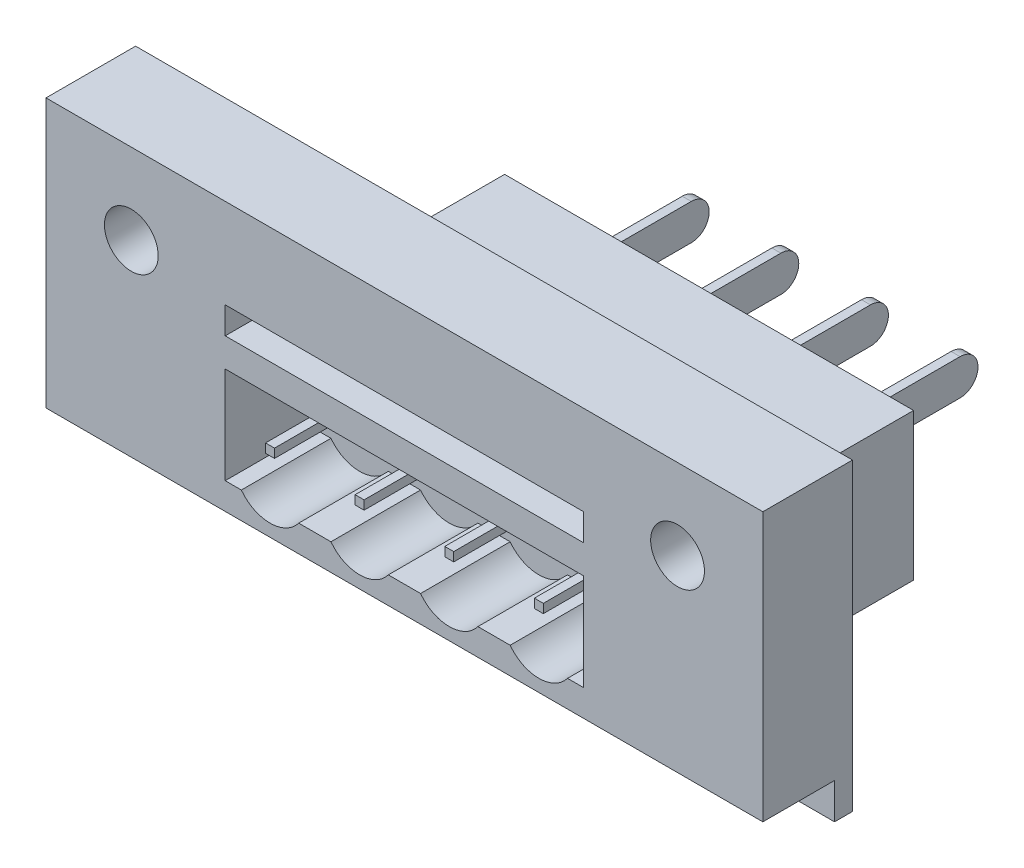
from build123d import *

# Parameters (mm, degrees)
SKETCH1_R              = 1.5
SKETCH1_W              = 20
SKETCH1_H              = 1.5
SKETCH1_W_2            = 22.82
SKETCH1_H_2            = 7.086
BOSS_EXTRUDE1_DEPTH    = 5
SKETCH1_3_W            = 22.82
SKETCH1_3_H            = 1.114
BOSS_EXTRUDE2_DEPTH    = 1
CUT_EXTRUDE1_DEPTH     = 23.696190187
LPATTERN1_COUNT        = 4
LPATTERN1_PITCH        = 5
BOSS_EXTRUDE3_START    = -12
SKETCH1_5_W            = 22.82
SKETCH1_5_H            = 7.086
SKETCH1_5_H_2          = 1.114
BOSS_EXTRUDE3_DEPTH    = 12
SKETCH4_W              = 0.5
SKETCH4_H              = 0.5
BOSS_EXTRUDE4_DEPTH    = 5
SKETCH5_W              = 0.5
SKETCH5_H              = 2
BOSS_EXTRUDE5_DEPTH    = 8
FILLET1_R              = 1
LPATTERN2_COUNT        = 4
LPATTERN2_PITCH        = 5
FILLET1_OF_LPATTERN2_R = 1


with BuildPart() as part:
    # Sketch1 → Boss-Extrude1 (new body)
    # profile 1 of 3: a face of its own
    with BuildSketch(Plane.XY):
        Polygon((20, 7.493), (-20, 7.493), (-20, -7.493), (-11.41, -7.493), (-11.41, -0.407), (11.41, -0.407), (11.41, -7.493), (20, -7.493), align=None)
        with Locations((-15.24, 2.993)):
            Circle(SKETCH1_R, mode=Mode.SUBTRACT)
        with Locations((0, 1.743)):
            Rectangle(SKETCH1_W, SKETCH1_H, mode=Mode.SUBTRACT)
        with Locations((15.24, 2.993)):
            Circle(SKETCH1_R, mode=Mode.SUBTRACT)
    # profile 2 of 3: a face of its own
    with BuildSketch(Plane.XY):
        with Locations((0, -3.95)):
            Rectangle(SKETCH1_W_2, SKETCH1_H_2)
        with BuildLine():
            Line((-10, -0.607), (-5, -0.607))
            Line((-5, -0.607), (-5, -6.007))
            Line((-5, -6.007), (-5.9, -6.007))
            ThreePointArc((-5.9, -6.007), (-7.5, -6.807), (-9.1, -6.007))
            Line((-9.1, -6.007), (-10, -6.007))
            Line((-10, -6.007), (-10, -0.607))
        make_face(mode=Mode.SUBTRACT)
    # profile 3 of 3: a face of its own
    with BuildSketch(Plane.XY):
        with BuildLine():
            Line((-10, -6.007), (-9.1, -6.007))
            ThreePointArc((-9.1, -6.007), (-7.5, -6.807), (-5.9, -6.007))
            Line((-5.9, -6.007), (-5, -6.007))
            Line((-5, -6.007), (-5, -0.607))
            Line((-5, -0.607), (-10, -0.607))
            Line((-10, -0.607), (-10, -6.007))
        make_face()
    extrude(amount=BOSS_EXTRUDE1_DEPTH)

    # Sketch1<3> → Boss-Extrude2 (add)
    with BuildSketch(Plane.XY):
        Polygon((-11.41, -7.493), (-20, -7.493), (-20, -9.493), (20, -9.493), (20, -7.493), (11.41, -7.493), (11.41, -8.607), (-11.41, -8.607), align=None)
        with Locations((0, -8.05)):
            Rectangle(SKETCH1_3_W, SKETCH1_3_H)
    extrude(amount=BOSS_EXTRUDE2_DEPTH)

    # Sketch1<4> → Cut-Extrude1 (cut, through all)
    with BuildSketch(Plane.XY):
        with BuildLine():
            Line((-10, -6.007), (-9.1, -6.007))
            ThreePointArc((-9.1, -6.007), (-7.5, -6.807), (-5.9, -6.007))
            Line((-5.9, -6.007), (-5, -6.007))
            Line((-5, -6.007), (-5, -0.607))
            Line((-5, -0.607), (-10, -0.607))
            Line((-10, -0.607), (-10, -6.007))
        make_face()
    cut_extrude1 = extrude(amount=CUT_EXTRUDE1_DEPTH, mode=Mode.SUBTRACT)

    # LPattern1: Cut-Extrude1 ×4
    with Locations(*[(i * LPATTERN1_PITCH, 0, 0) for i in range(1, LPATTERN1_COUNT)]):
        add(cut_extrude1, mode=Mode.SUBTRACT)

    # Sketch1<5> → Boss-Extrude3 (add)
    # profile 1 of 3: a face of its own
    with BuildSketch(Plane.XY.offset(BOSS_EXTRUDE3_START)):
        with Locations((0, -3.95)):
            Rectangle(SKETCH1_5_W, SKETCH1_5_H)
        with BuildLine():
            Line((-10, -0.607), (-5, -0.607))
            Line((-5, -0.607), (-5, -6.007))
            Line((-5, -6.007), (-5.9, -6.007))
            ThreePointArc((-5.9, -6.007), (-7.5, -6.807), (-9.1, -6.007))
            Line((-9.1, -6.007), (-10, -6.007))
            Line((-10, -6.007), (-10, -0.607))
        make_face(mode=Mode.SUBTRACT)
    # profile 2 of 3: a face of its own
    with BuildSketch(Plane.XY.offset(BOSS_EXTRUDE3_START)):
        with BuildLine():
            Line((-10, -6.007), (-9.1, -6.007))
            ThreePointArc((-9.1, -6.007), (-7.5, -6.807), (-5.9, -6.007))
            Line((-5.9, -6.007), (-5, -6.007))
            Line((-5, -6.007), (-5, -0.607))
            Line((-5, -0.607), (-10, -0.607))
            Line((-10, -0.607), (-10, -6.007))
        make_face()
    # profile 3 of 3: a face of its own
    with BuildSketch(Plane.XY.offset(BOSS_EXTRUDE3_START)):
        with Locations((0, -8.05)):
            Rectangle(SKETCH1_5_W, SKETCH1_5_H_2)
    extrude(amount=BOSS_EXTRUDE3_DEPTH)

    # Sketch4 → Boss-Extrude4 (add)
    with BuildSketch(Plane.XY):
        with Locations((-7.5, -3.307)):
            Rectangle(SKETCH4_W, SKETCH4_H)
    boss_extrude4 = extrude(amount=BOSS_EXTRUDE4_DEPTH)

    # Sketch5 → Boss-Extrude5 (add)
    with BuildSketch(Plane(origin=(0, 0, -12), x_dir=(-1, 0, 0), z_dir=(0, 0, -1))):
        with Locations((8.245, -4.507)):
            Rectangle(SKETCH5_W, SKETCH5_H)
    boss_extrude5 = extrude(amount=BOSS_EXTRUDE5_DEPTH)

    # Fillet1
    fillet1_edges = [part.edges().sort_by_distance(p)[0] for p in [
        (-8.245, -5.507, -20),
        (-8.245, -3.507, -20),
    ]]
    fillet(fillet1_edges, radius=FILLET1_R - 0.0001)  # a hair under: the kernel refuses the full size

    # LPattern2: Boss-Extrude4, Boss-Extrude5 ×4
    with Locations(*[(i * LPATTERN2_PITCH, 0, 0) for i in range(1, LPATTERN2_COUNT)]):
        add(boss_extrude4)
        add(boss_extrude5)

    # Fillet1 of LPattern2
    fillet1_of_lpattern2_edges = [part.edges().sort_by_distance(p)[0] for p in [
        (-3.245, -5.507, -20),
        (-3.245, -3.507, -20),
        (1.755, -5.507, -20),
        (1.755, -3.507, -20),
        (6.755, -5.507, -20),
        (6.755, -3.507, -20),
    ]]
    fillet(fillet1_of_lpattern2_edges, radius=FILLET1_OF_LPATTERN2_R - 0.0001)  # a hair under: the kernel refuses the full size


solid = part.part
